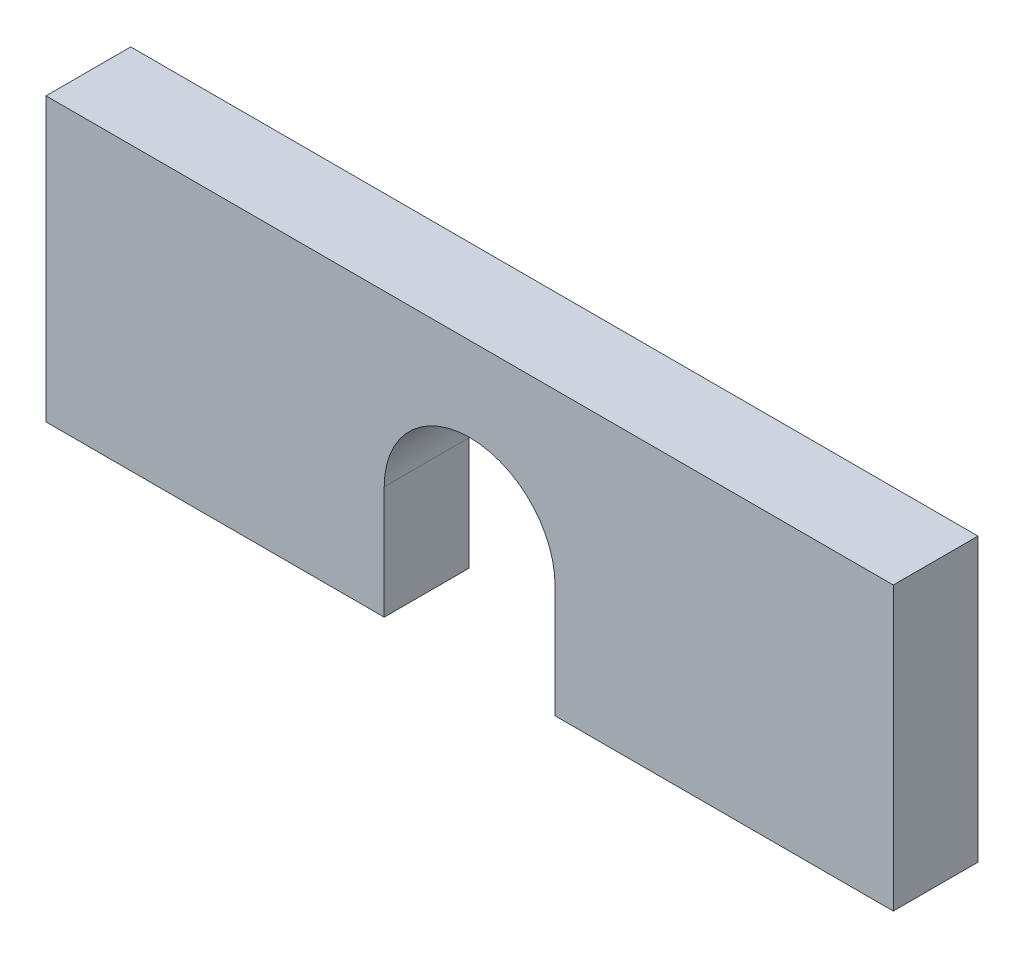
from build123d import *

# Parameters (mm, degrees)
SKETCH_1_W          = 60
SKETCH_1_H          = 20
EXTRUDE_1_DEPTH     = 6
CUT_EXTRUDE_1_DEPTH = 47.467788516


with BuildPart() as part:
    # Эскиз1 → Бобышка-Вытянуть1 (new body)
    with BuildSketch(Plane.XY):
        with Locations((4.02043073, 21.078379342)):
            Rectangle(SKETCH_1_W, SKETCH_1_H)
    extrude(amount=EXTRUDE_1_DEPTH)

    # Эскиз2 → Вырез-Вытянуть1 (cut, through all)
    with BuildSketch(Plane.XY.offset(6)):
        with BuildLine():
            Line((-2.02956927, 11.078379342), (-2.02956927, 19.078379342))
            ThreePointArc((-2.02956927, 19.078379342), (4.02043073, 25.128379342), (10.07043073, 19.078379342))
            Line((10.07043073, 19.078379342), (10.07043073, 11.078379342))
            ThreePointArc((10.07043073, 11.078379342), (4.02043073, 5.028379342), (-2.02956927, 11.078379342))
        make_face()
    extrude(amount=-CUT_EXTRUDE_1_DEPTH, mode=Mode.SUBTRACT)


solid = part.part
